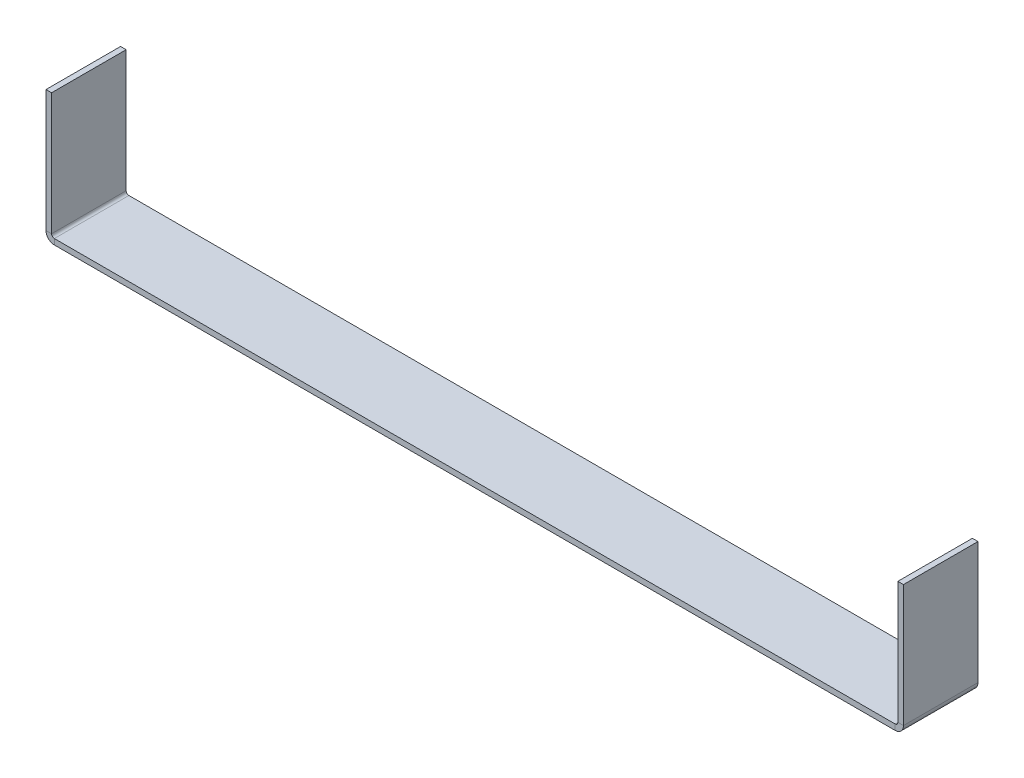
from build123d import *

# Parameters (mm, degrees)
SKETCH_1_W                       = 230
SKETCH_1_H                       = 20
SM_BASE_FLANGE_1_DEPTH           = 1.5
SM_EDGE_FLANGE_1_STRIP_W         = 7.4732
SM_EDGE_FLANGE_1_STRIP_H         = 1.5
SM_EDGE_FLANGE_1_STRIP_CUT_DEPTH = 20
SM_EDGE_FLANGE_1_DEPTH           = 20
SM_EDGE_FLANGE_2_STRIP_W         = 7.4732
SM_EDGE_FLANGE_2_STRIP_H         = 1.5
SM_EDGE_FLANGE_2_STRIP_CUT_DEPTH = 20
SM_EDGE_FLANGE_2_DEPTH           = 20


# Sheet-metal steps are written as plain solids
with BuildPart() as part:
    # Sketch 1 → Базовая кромка1 (new body)
    with BuildSketch(Plane(origin=(0, 0, 0), x_dir=(1, 0, 0), z_dir=(0, 1, 0))):
        with Locations((115, 10)):
            Rectangle(SKETCH_1_W, SKETCH_1_H)
    extrude(amount=-SM_BASE_FLANGE_1_DEPTH)

    # Ребро-кромка1 strip (across the edge) → Ребро-кромка1 strip cut (cut)
    with BuildSketch(Plane.XY.offset(-20)):
        with Locations((-1.5, -0.75)):
            Rectangle(SM_EDGE_FLANGE_1_STRIP_W, SM_EDGE_FLANGE_1_STRIP_H)
    extrude(amount=SM_EDGE_FLANGE_1_STRIP_CUT_DEPTH, mode=Mode.SUBTRACT)

    # Ребро-кромка1 section (across the edge) → Ребро-кромка1 (add)
    with BuildSketch(Plane.XY.offset(-20)):
        with BuildLine():
            Line((0, 0.7366), (0, 33.5))
            Line((0, 33.5), (1.5, 33.5))
            Line((1.5, 33.5), (1.5, 0.7366))
            ThreePointArc((1.5, 0.7366), (1.715745145, 0.215745145), (2.2366, 0))
            Line((2.2366, 0), (2.2366, -1.5))
            ThreePointArc((2.2366, -1.5), (0.655084973, -0.844915027), (0, 0.7366))
        make_face()
    extrude(amount=SM_EDGE_FLANGE_1_DEPTH)

    # Ребро-кромка2 strip (across the edge) → Ребро-кромка2 strip cut (cut)
    with BuildSketch(Plane(origin=(230, 0, 0), x_dir=(-1, 0, 0), z_dir=(0, 0, -1))):
        with Locations((-1.5, -0.75)):
            Rectangle(SM_EDGE_FLANGE_2_STRIP_W, SM_EDGE_FLANGE_2_STRIP_H)
    extrude(amount=SM_EDGE_FLANGE_2_STRIP_CUT_DEPTH, mode=Mode.SUBTRACT)

    # Ребро-кромка2 section (across the edge) → Ребро-кромка2 (add)
    with BuildSketch(Plane(origin=(230, 0, 0), x_dir=(-1, 0, 0), z_dir=(0, 0, -1))):
        with BuildLine():
            Line((0, 0.7366), (0, 33.5))
            Line((0, 33.5), (1.5, 33.5))
            Line((1.5, 33.5), (1.5, 0.7366))
            ThreePointArc((1.5, 0.7366), (1.715745145, 0.215745145), (2.2366, 0))
            Line((2.2366, 0), (2.2366, -1.5))
            ThreePointArc((2.2366, -1.5), (0.655084973, -0.844915027), (0, 0.7366))
        make_face()
    extrude(amount=SM_EDGE_FLANGE_2_DEPTH)


solid = part.part
